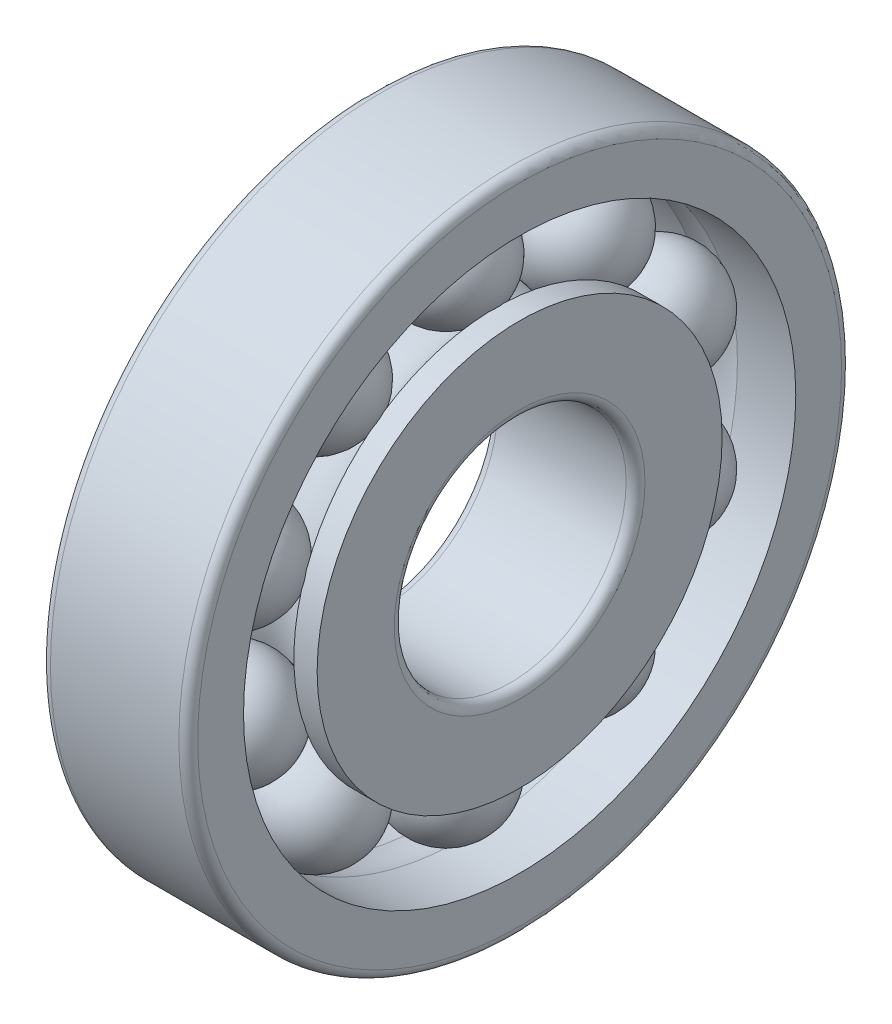
from build123d import *

# Parameters (mm, degrees)
CAGSPISKE_W         = 0.47625
CAGSPISKE_H         = 0.79375
CAGESPINE_ANGLE     = 0.001
BALLSDETAILED_COUNT = 10
BALLSDETAILED_ANGLE = 324


with BuildPart() as part:
    # CagSpiSke → CageSpine (revolve)
    with BuildSketch(Plane.XY):
        with Locations((0, 9.64375)):
            Rectangle(CAGSPISKE_W, CAGSPISKE_H)
    revolve(axis=Axis((-20.6375, 0, 0), (1, 0, 0)), revolution_arc=CAGESPINE_ANGLE)

    # BalDetSke → BallDetailed (revolve)
    with BuildSketch(Plane.XY):
        with BuildLine():
            Line((-2.38125, 9.64375), (2.38125, 9.64375))
            ThreePointArc((2.38125, 9.64375), (0, 7.2625), (-2.38125, 9.64375))
        make_face()
    balldetailed = revolve(axis=Axis((-1.905, 9.64375, 0), (1, 0, 0)))

    # InnRacSke → InnerRace (revolve)
    with BuildSketch(Plane.XY):
        with BuildLine():
            Line((-2.172385282, 8.73125), (-3.175, 8.73125))
            Line((-3.175, 8.73125), (-3.175, 5.4064))
            ThreePointArc((-3.175, 5.4064), (-3.055968196, 5.119031804), (-2.7686, 5))
            Line((-2.7686, 5), (2.7686, 5))
            ThreePointArc((2.7686, 5), (3.055968196, 5.119031804), (3.175, 5.4064))
            Line((3.175, 5.4064), (3.175, 8.73125))
            Line((3.175, 8.73125), (2.172385282, 8.73125))
            ThreePointArc((2.172385282, 8.73125), (0, 7.2875), (-2.172385282, 8.73125))
        make_face()
    revolve(axis=Axis((-20.6375, 0, 0), (1, 0, 0)))

    # OutRacSke → OuterRace (revolve)
    with BuildSketch(Plane.XY):
        with BuildLine():
            Line((-0.658033291, 11.90625), (-3.175, 11.90625))
            Line((-3.175, 11.90625), (-3.175, 13.8811))
            ThreePointArc((-3.175, 13.8811), (-3.055968196, 14.168468196), (-2.7686, 14.2875))
            Line((-2.7686, 14.2875), (2.7686, 14.2875))
            ThreePointArc((2.7686, 14.2875), (3.055968196, 14.168468196), (3.175, 13.8811))
            Line((3.175, 13.8811), (3.175, 11.90625))
            Line((3.175, 11.90625), (0.658033291, 11.90625))
            ThreePointArc((0.658033291, 11.90625), (0, 12), (-0.658033291, 11.90625))
        make_face()
    revolve(axis=Axis((-20.6375, 0, 0), (1, 0, 0)))

    # BallsDetailed: BallDetailed ×10 about axis
    ballsdetailed_axis = Axis((-50, 0, 0), (1, 0, 0))
    for i in range(1, BALLSDETAILED_COUNT):
        add(balldetailed.rotate(ballsdetailed_axis, i * BALLSDETAILED_ANGLE / (BALLSDETAILED_COUNT - 1)))


solid = part.part
